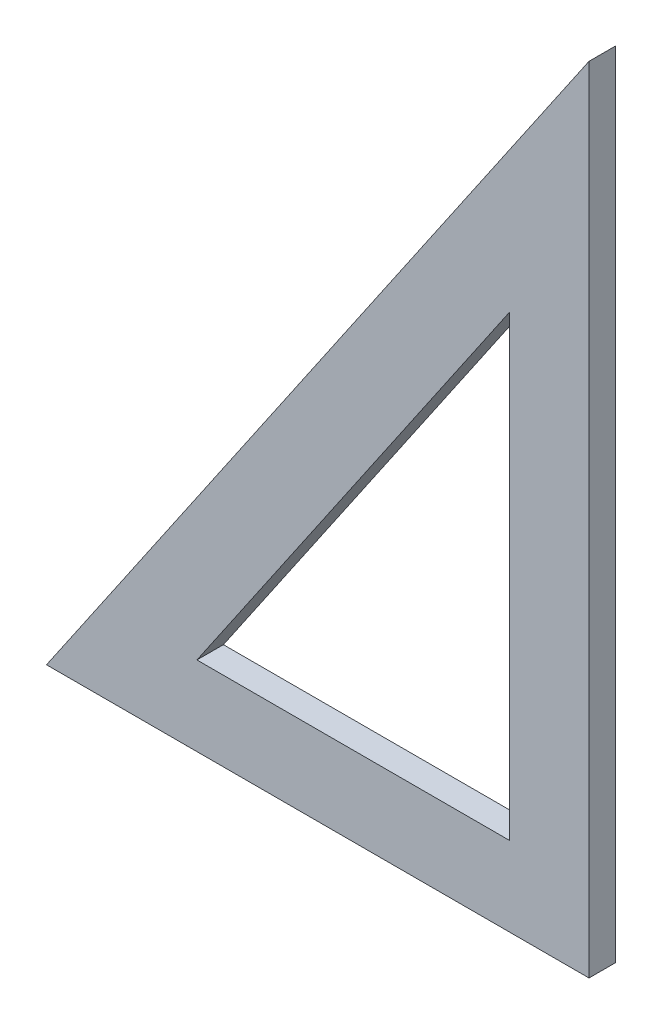
from build123d import *

# Parameters (mm, degrees)
BOSS_EXTRUDE1_DEPTH = 3.175
CUT_EXTRUDE1_DEPTH  = 295.23189409


with BuildPart() as part:
    # Sketch1 → Boss-Extrude1 (new, symmetric)
    with BuildSketch(Plane.XY):
        Polygon((69.85, 285.75), (69.85, 95.25), (-60.325, 95.25), align=None)
    extrude(amount=BOSS_EXTRUDE1_DEPTH, both=True)

    # Sketch2 → Cut-Extrude1 (cut, through all)
    with BuildSketch(Plane.XY.offset(3.175)):
        Polygon((-24.23461968, 114.3), (50.8, 114.3), (50.8, 224.106760508), align=None)
    extrude(amount=-CUT_EXTRUDE1_DEPTH, mode=Mode.SUBTRACT)


solid = part.part
